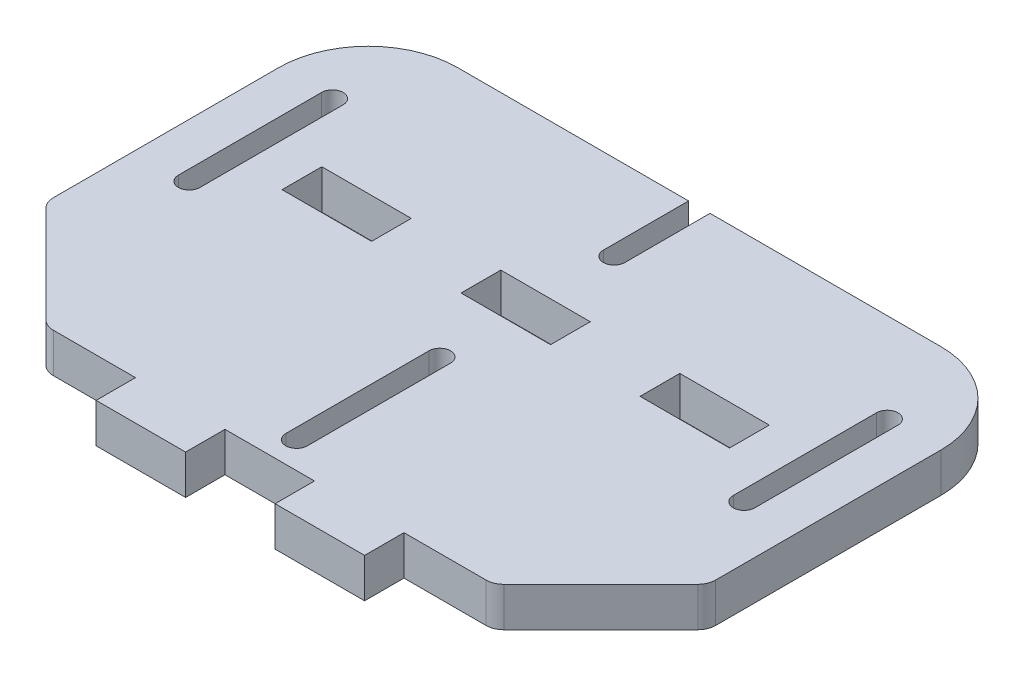
from build123d import *

# Parameters (mm, degrees)
BOSS_EXTRUDE6_DEPTH = 11
SKETCH4_W           = 25
SKETCH4_H           = 11
SKETCH4_H_2         = 11.1
CUT_EXTRUDE1_DEPTH  = 199.489924177
FILLET1_R           = 25
FILLET2_R           = 5


with BuildPart() as part:
    # Sketch1 → Boss-Extrude6 (new body)
    with BuildSketch(Plane(origin=(0, 0, 0), x_dir=(1, 0, 0), z_dir=(0, 1, 0))):
        with BuildLine():
            Line((0, -7.5), (125, -7.5))
            Line((125, -7.5), (125, 3.5))
            Line((125, 3.5), (155, 33.5))
            Line((155, 33.5), (155, 123.5))
            Line((155, 123.5), (65.5, 123.5))
            Line((65.5, 123.5), (65.5, 99.705746838))
            ThreePointArc((65.5, 99.705746838), (62.5, 96.705746838), (59.5, 99.705746838))
            Line((59.5, 99.705746838), (59.5, 123.5))
            Line((59.5, 123.5), (-30, 123.5))
            Line((-30, 123.5), (-30, 33.5))
            Line((-30, 33.5), (0, 3.5))
            Line((0, 3.5), (0, -7.5))
        make_face()
        with BuildLine():
            Line((137, 58.5), (137, 98.5))
            ThreePointArc((137, 98.5), (140, 101.5), (143, 98.5))
            Line((143, 98.5), (143, 58.5))
            ThreePointArc((143, 58.5), (140, 55.5), (137, 58.5))
        make_face(mode=Mode.SUBTRACT)
        with BuildLine():
            Line((-18, 58.5), (-18, 98.5))
            ThreePointArc((-18, 98.5), (-15, 101.5), (-12, 98.5))
            Line((-12, 98.5), (-12, 58.5))
            ThreePointArc((-12, 58.5), (-15, 55.5), (-18, 58.5))
        make_face(mode=Mode.SUBTRACT)
        with BuildLine():
            Line((59.5, 11), (59.5, 51))
            ThreePointArc((59.5, 51), (62.5, 54), (65.5, 51))
            Line((65.5, 51), (65.5, 11))
            ThreePointArc((65.5, 11), (62.5, 8), (59.5, 11))
        make_face(mode=Mode.SUBTRACT)
    extrude(amount=BOSS_EXTRUDE6_DEPTH)

    # Sketch4 → Cut-Extrude1 (cut, through all)
    with BuildSketch(Plane(origin=(0, 11, 0), x_dir=(1, 0, 0), z_dir=(0, 1, 0))):
        with Locations((12.5, -2)):
            Rectangle(SKETCH4_W, SKETCH4_H)
        with Locations((62.5, -2)):
            Rectangle(SKETCH4_W, SKETCH4_H)
        with Locations((12.5, 75)):
            Rectangle(SKETCH4_W, SKETCH4_H_2)
        with Locations((112.5, -2)):
            Rectangle(SKETCH4_W, SKETCH4_H)
        with Locations((62.5, 75)):
            Rectangle(SKETCH4_W, SKETCH4_H_2)
        with Locations((112.5, 75)):
            Rectangle(SKETCH4_W, SKETCH4_H_2)
    extrude(amount=-CUT_EXTRUDE1_DEPTH, mode=Mode.SUBTRACT)

    # Fillet1
    fillet1_edges = [part.edges().sort_by_distance(p)[0] for p in [
        (155, 5.5, -123.5),
        (-30, 5.5, -123.5),
    ]]
    fillet(fillet1_edges, radius=FILLET1_R)

    # Fillet2
    fillet2_edges = [part.edges().sort_by_distance(p)[0] for p in [
        (155, 5.5, -33.5),
        (125, 5.5, -3.5),
        (0, 5.5, -3.5),
        (-30, 5.5, -33.5),
    ]]
    fillet(fillet2_edges, radius=FILLET2_R)


solid = part.part
